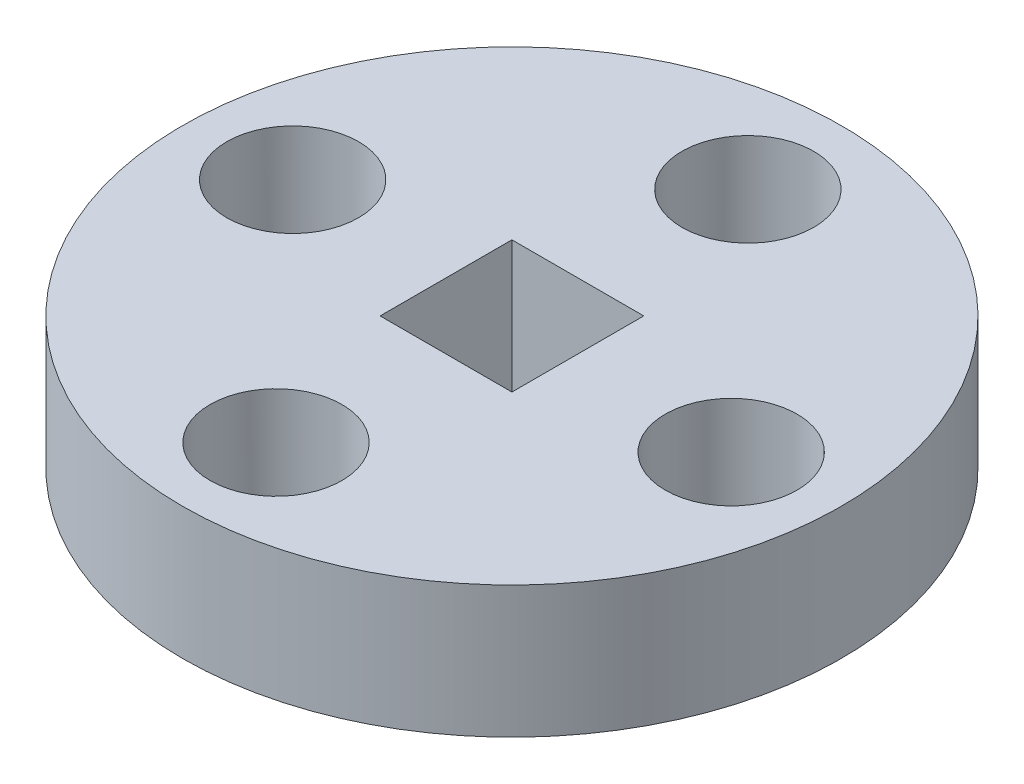
from build123d import *

# Parameters (mm, degrees)
SKIZZE1_R                       = 5
AUFSATZ_LINEAR_AUSTRAGEN1_DEPTH = 2
SKIZZE3_W                       = 2
SKIZZE3_H                       = 2
SCHNITT_LINEAR_AUSTRAGEN1_DEPTH = 3
SKIZZE4_R                       = 1
SCHNITT_LINEAR_AUSTRAGEN2_DEPTH = 3
KREISMUSTER1_COUNT              = 4


with BuildPart() as part:
    # Skizze1 → Aufsatz-Linear austragen1 (new body)
    with BuildSketch(Plane(origin=(0, 0, 0), x_dir=(1, 0, 0), z_dir=(0, 1, 0))):
        Circle(SKIZZE1_R)
    extrude(amount=AUFSATZ_LINEAR_AUSTRAGEN1_DEPTH)

    # Skizze3 → Schnitt-Linear austragen1 (cut)
    with BuildSketch(Plane(origin=(0, 2, 0), x_dir=(1, 0, 0), z_dir=(0, 1, 0))):
        Rectangle(SKIZZE3_W, SKIZZE3_H)
    extrude(amount=-SCHNITT_LINEAR_AUSTRAGEN1_DEPTH, mode=Mode.SUBTRACT)

    # Skizze4 → Schnitt-Linear austragen2 (cut)
    with BuildSketch(Plane(origin=(0, 2, 0), x_dir=(1, 0, 0), z_dir=(0, 1, 0))):
        with Locations((3.452809927, -0.126446108)):
            Circle(SKIZZE4_R)
    schnitt_linear_austragen2 = extrude(amount=-SCHNITT_LINEAR_AUSTRAGEN2_DEPTH, mode=Mode.SUBTRACT)

    # Kreismuster1: Schnitt-Linear austragen2 ×4 about axis
    kreismuster1_axis = Axis((0, 2, 0), (0, -1, 0))
    for i in range(1, KREISMUSTER1_COUNT):
        add(schnitt_linear_austragen2.rotate(kreismuster1_axis, i * 360 / KREISMUSTER1_COUNT), mode=Mode.SUBTRACT)


solid = part.part
